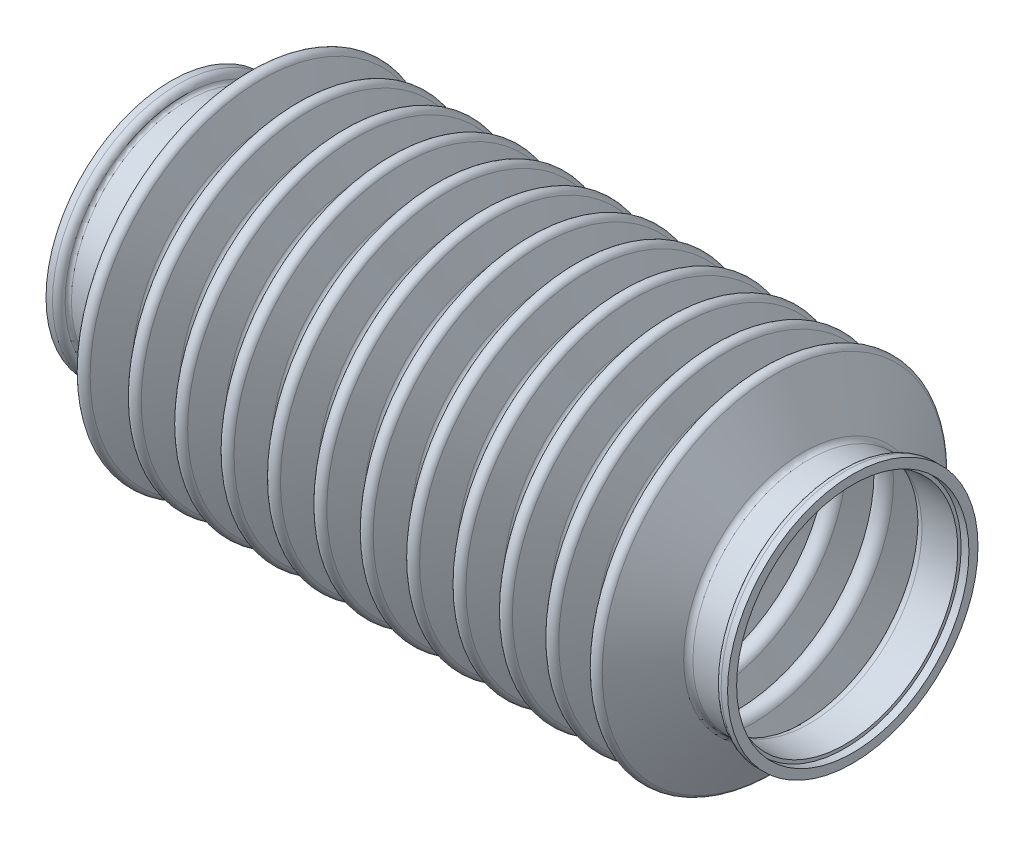
from build123d import *


with BuildPart() as part:
    # Croquis1 → Revolución1 (revolve)
    with BuildSketch(Plane.XY):
        with BuildLine():
            Line((-66.121380019, 37.792103947), (-66.121380019, 35.058644904))
            Line((-66.121380019, 35.058644904), (-63.767675359, 35.058644904))
            Line((-63.767675359, 35.058644904), (-63.767675359, 34.058644904))
            Line((-63.767675359, 34.058644904), (-61.183599677, 34.058644904))
            Line((-61.183599677, 34.058644904), (-52.934724597, 34.058644904))
            ThreePointArc((-52.934724597, 34.058644904), (-51.409235337, 34.475452593), (-50.307636512, 35.610056559))
            Line((-50.307636512, 35.610056559), (-41.566637614, 51.462299291))
            ThreePointArc((-41.566637614, 51.462299291), (-40.634754046, 51.977856741), (-39.766598749, 51.360999506))
            Line((-39.766598749, 51.360999506), (-36.049094983, 42.355283536))
            ThreePointArc((-36.049094983, 42.355283536), (-33.276066474, 40.499972527), (-30.503037964, 42.355283536))
            Line((-30.503037964, 42.355283536), (-27.20040931, 50.355957505))
            ThreePointArc((-27.20040931, 50.355957505), (-26.276066474, 50.974394508), (-25.351723637, 50.355957505))
            Line((-25.351723637, 50.355957505), (-22.049094983, 42.355283536))
            ThreePointArc((-22.049094983, 42.355283536), (-19.276066474, 40.499972527), (-16.503037964, 42.355283536))
            Line((-16.503037964, 42.355283536), (-13.20040931, 50.355957505))
            ThreePointArc((-13.20040931, 50.355957505), (-12.276066474, 50.974394508), (-11.351723637, 50.355957505))
            Line((-11.351723637, 50.355957505), (-8.049094983, 42.355283536))
            ThreePointArc((-8.049094983, 42.355283536), (-5.276066474, 40.499972527), (-2.503037964, 42.355283536))
            Line((-2.503037964, 42.355283536), (0.79959069, 50.355957505))
            ThreePointArc((0.79959069, 50.355957505), (1.723933526, 50.974394508), (2.648276363, 50.355957505))
            Line((2.648276363, 50.355957505), (5.950905017, 42.355283536))
            ThreePointArc((5.950905017, 42.355283536), (8.723933526, 40.499972527), (11.496962036, 42.355283536))
            Line((11.496962036, 42.355283536), (14.79959069, 50.355957505))
            ThreePointArc((14.79959069, 50.355957505), (15.723933526, 50.974394508), (16.648276363, 50.355957505))
            Line((16.648276363, 50.355957505), (19.950905017, 42.355283536))
            ThreePointArc((19.950905017, 42.355283536), (22.723933526, 40.499972527), (25.496962036, 42.355283536))
            Line((25.496962036, 42.355283536), (28.79959069, 50.355957505))
            ThreePointArc((28.79959069, 50.355957505), (29.723933526, 50.974394508), (30.648276363, 50.355957505))
            Line((30.648276363, 50.355957505), (33.950905017, 42.355283536))
            ThreePointArc((33.950905017, 42.355283536), (35.055710965, 41.006574547), (36.723933526, 40.499972527))
            ThreePointArc((36.723933526, 40.499972527), (38.392156088, 41.006574547), (39.496962036, 42.355283536))
            Line((39.496962036, 42.355283536), (42.79959069, 50.355957505))
            ThreePointArc((42.79959069, 50.355957505), (43.723933526, 50.974394508), (44.648276363, 50.355957505))
            Line((44.648276363, 50.355957505), (47.950905017, 42.355283536))
            ThreePointArc((47.950905017, 42.355283536), (50.723933526, 40.499972527), (53.496962036, 42.355283536))
            Line((53.496962036, 42.355283536), (56.79959069, 50.355957505))
            ThreePointArc((56.79959069, 50.355957505), (57.723933526, 50.974394508), (58.648276363, 50.355957505))
            Line((58.648276363, 50.355957505), (61.950905017, 42.355283536))
            ThreePointArc((61.950905017, 42.355283536), (64.723933526, 40.499972527), (67.496962036, 42.355283536))
            Line((67.496962036, 42.355283536), (70.79959069, 50.355957505))
            ThreePointArc((70.79959069, 50.355957505), (71.723933526, 50.974394508), (72.648276363, 50.355957505))
            Line((72.648276363, 50.355957505), (75.950905017, 42.355283536))
            ThreePointArc((75.950905017, 42.355283536), (78.723933526, 40.499972527), (81.496962036, 42.355283536))
            Line((81.496962036, 42.355283536), (84.79959069, 50.355957505))
            ThreePointArc((84.79959069, 50.355957505), (85.723933526, 50.974394508), (86.648276363, 50.355957505))
            Line((86.648276363, 50.355957505), (89.950905017, 42.355283536))
            ThreePointArc((89.950905017, 42.355283536), (92.723933526, 40.499972527), (95.496962036, 42.355283536))
            Line((95.496962036, 42.355283536), (98.79959069, 50.355957505))
            ThreePointArc((98.79959069, 50.355957505), (99.723933526, 50.974394508), (100.648276363, 50.355957505))
            Line((100.648276363, 50.355957505), (103.950905017, 42.355283536))
            ThreePointArc((103.950905017, 42.355283536), (106.723933526, 40.499972527), (109.496962036, 42.355283536))
            Line((109.496962036, 42.355283536), (113.214465802, 51.360999506))
            ThreePointArc((113.214465802, 51.360999506), (114.082621099, 51.977856741), (115.014504667, 51.462299291))
            Line((115.014504667, 51.462299291), (123.755503565, 35.610056559))
            ThreePointArc((123.755503565, 35.610056559), (124.85710239, 34.475452593), (126.38259165, 34.058644904))
            Line((126.38259165, 34.058644904), (134.63146673, 34.058644904))
            Line((134.63146673, 34.058644904), (137.215542412, 34.058644904))
            Line((137.215542412, 34.058644904), (137.215542412, 35.058644904))
            Line((137.215542412, 35.058644904), (139.569247072, 35.058644904))
            Line((139.569247072, 35.058644904), (139.569247072, 37.792103947))
            Line((139.569247072, 37.792103947), (137.61960259, 37.792103947))
            ThreePointArc((137.61960259, 37.792103947), (136.269674433, 37.267805127), (135.627512017, 35.969797918))
            ThreePointArc((135.627512017, 35.969797918), (135.306430809, 35.320794314), (134.63146673, 35.058644904))
            Line((134.63146673, 35.058644904), (126.38259165, 35.058644904))
            ThreePointArc((126.38259165, 35.058644904), (125.36559881, 35.336516697), (124.631199593, 36.092919341))
            Line((124.631199593, 36.092919341), (115.890200695, 51.945162072))
            ThreePointArc((115.890200695, 51.945162072), (114.02643356, 52.976276974), (112.290122966, 51.742562503))
            Line((112.290122966, 51.742562503), (108.572619199, 42.736846533))
            ThreePointArc((108.572619199, 42.736846533), (106.723933526, 41.499972527), (104.875247853, 42.736846533))
            Line((104.875247853, 42.736846533), (101.572619199, 50.737520502))
            ThreePointArc((101.572619199, 50.737520502), (99.723933526, 51.974394508), (97.875247853, 50.737520502))
            Line((97.875247853, 50.737520502), (94.572619199, 42.736846533))
            ThreePointArc((94.572619199, 42.736846533), (92.723933526, 41.499972527), (90.875247853, 42.736846533))
            Line((90.875247853, 42.736846533), (87.572619199, 50.737520502))
            ThreePointArc((87.572619199, 50.737520502), (85.723933526, 51.974394508), (83.875247853, 50.737520502))
            Line((83.875247853, 50.737520502), (80.572619199, 42.736846533))
            ThreePointArc((80.572619199, 42.736846533), (78.723933526, 41.499972527), (76.875247853, 42.736846533))
            Line((76.875247853, 42.736846533), (73.572619199, 50.737520502))
            ThreePointArc((73.572619199, 50.737520502), (71.723933526, 51.974394508), (69.875247853, 50.737520502))
            Line((69.875247853, 50.737520502), (66.572619199, 42.736846533))
            ThreePointArc((66.572619199, 42.736846533), (64.723933526, 41.499972527), (62.875247853, 42.736846533))
            Line((62.875247853, 42.736846533), (59.572619199, 50.737520502))
            ThreePointArc((59.572619199, 50.737520502), (57.723933526, 51.974394508), (55.875247853, 50.737520502))
            Line((55.875247853, 50.737520502), (52.572619199, 42.736846533))
            ThreePointArc((52.572619199, 42.736846533), (50.723933526, 41.499972527), (48.875247853, 42.736846533))
            Line((48.875247853, 42.736846533), (45.572619199, 50.737520502))
            ThreePointArc((45.572619199, 50.737520502), (43.723933526, 51.974394508), (41.875247853, 50.737520502))
            Line((41.875247853, 50.737520502), (38.572619199, 42.736846533))
            ThreePointArc((38.572619199, 42.736846533), (37.8360819, 41.837707207), (36.723933526, 41.499972527))
            ThreePointArc((36.723933526, 41.499972527), (35.611785152, 41.837707207), (34.875247853, 42.736846533))
            Line((34.875247853, 42.736846533), (31.572619199, 50.737520502))
            ThreePointArc((31.572619199, 50.737520502), (29.723933526, 51.974394508), (27.875247853, 50.737520502))
            Line((27.875247853, 50.737520502), (24.572619199, 42.736846533))
            ThreePointArc((24.572619199, 42.736846533), (22.723933526, 41.499972527), (20.875247853, 42.736846533))
            Line((20.875247853, 42.736846533), (17.572619199, 50.737520502))
            ThreePointArc((17.572619199, 50.737520502), (15.723933526, 51.974394508), (13.875247853, 50.737520502))
            Line((13.875247853, 50.737520502), (10.572619199, 42.736846533))
            ThreePointArc((10.572619199, 42.736846533), (8.723933526, 41.499972527), (6.875247853, 42.736846533))
            Line((6.875247853, 42.736846533), (3.572619199, 50.737520502))
            ThreePointArc((3.572619199, 50.737520502), (1.723933526, 51.974394508), (-0.124752147, 50.737520502))
            Line((-0.124752147, 50.737520502), (-3.427380801, 42.736846533))
            ThreePointArc((-3.427380801, 42.736846533), (-5.276066474, 41.499972527), (-7.124752147, 42.736846533))
            Line((-7.124752147, 42.736846533), (-10.427380801, 50.737520502))
            ThreePointArc((-10.427380801, 50.737520502), (-12.276066474, 51.974394508), (-14.124752147, 50.737520502))
            Line((-14.124752147, 50.737520502), (-17.427380801, 42.736846533))
            ThreePointArc((-17.427380801, 42.736846533), (-19.276066474, 41.499972527), (-21.124752147, 42.736846533))
            Line((-21.124752147, 42.736846533), (-24.427380801, 50.737520502))
            ThreePointArc((-24.427380801, 50.737520502), (-26.276066474, 51.974394508), (-28.124752147, 50.737520502))
            Line((-28.124752147, 50.737520502), (-31.427380801, 42.736846533))
            ThreePointArc((-31.427380801, 42.736846533), (-33.276066474, 41.499972527), (-35.124752147, 42.736846533))
            Line((-35.124752147, 42.736846533), (-38.842255913, 51.742562503))
            ThreePointArc((-38.842255913, 51.742562503), (-40.578566507, 52.976276974), (-42.442333643, 51.945162072))
            Line((-42.442333643, 51.945162072), (-51.18333254, 36.092919341))
            ThreePointArc((-51.18333254, 36.092919341), (-51.917731757, 35.336516697), (-52.934724597, 35.058644904))
            Line((-52.934724597, 35.058644904), (-61.183599677, 35.058644904))
            ThreePointArc((-61.183599677, 35.058644904), (-61.858563756, 35.320794314), (-62.179644964, 35.969797918))
            ThreePointArc((-62.179644964, 35.969797918), (-62.821807381, 37.267805127), (-64.171735537, 37.792103947))
            Line((-64.171735537, 37.792103947), (-66.121380019, 37.792103947))
        make_face()
    revolve(axis=Axis((-62.171735537, 0, 0), (1, 0, 0)))


solid = part.part
